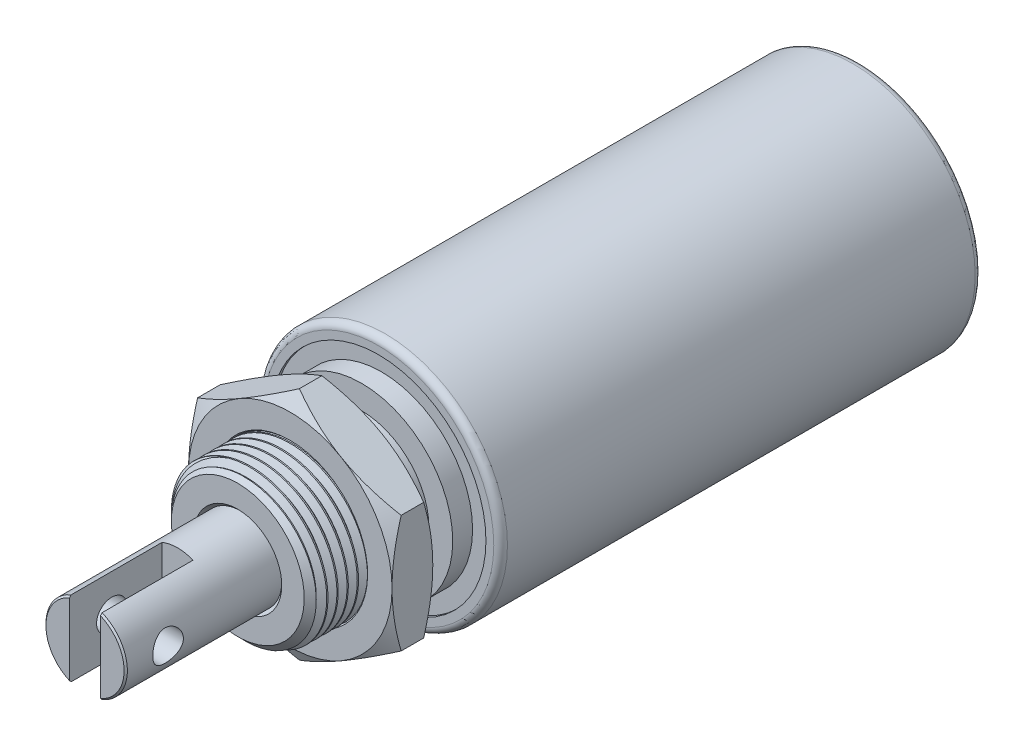
from build123d import *

# Parameters (mm, degrees)
CUT_EXTRUDE1_REACH                  = 43.339
CUT_EXTRUDE1_END_RADIUS             = 3.175
SKETCH4_W                           = 7.2136
SKETCH4_H                           = 2.413
CUT_EXTRUDE1_DIRECTION_2_REACH      = 43.339
CUT_EXTRUDE1_DIRECTION_2_END_RADIUS = 3.175
CUT_EXTRUDE2_REACH                  = 43.339
CUT_EXTRUDE2_END_RADIUS             = 3.175
SKETCH5_R                           = 1.1938
CUT_EXTRUDE2_DIRECTION_2_REACH      = 43.339
CUT_EXTRUDE2_DIRECTION_2_END_RADIUS = 3.175
CUT_SWEEP1_PITCH                    = 0.79375
BOSS_EXTRUDE3_START                 = 2.38125
SKETCH10_R                          = 5.9436
BOSS_EXTRUDE3_DEPTH                 = 3.175


with BuildPart() as part:
    # Sketch1 → Revolve1 (revolve)
    with BuildSketch(Plane(origin=(0, 0, 0), x_dir=(0, 0, -1), z_dir=(1, 0, 0)), mode=Mode.PRIVATE) as revolve1_sk:
        with BuildLine():
            Line((38.3286, 9.525), (1.8542, 9.525))
            ThreePointArc((1.8542, 9.525), (1.477029243, 9.368770757), (1.3208, 8.9916))
            Line((1.3208, 8.9916), (1.3208, 8.382))
            Line((1.3208, 8.382), (1.5494, 8.382))
            Line((1.5494, 8.382), (1.5494, 7.112))
            Line((1.5494, 7.112), (0, 7.112))
            Line((0, 7.112), (0, 0))
            Line((0, 0), (39.08298, 0))
            Line((39.08298, 0), (39.08298, 2.0066))
            ThreePointArc((39.08298, 2.0066), (39.018256457, 2.162856457), (38.862, 2.22758))
            Line((38.862, 2.22758), (38.862, 8.9916))
            ThreePointArc((38.862, 8.9916), (38.705770757, 9.368770757), (38.3286, 9.525))
        make_face()
    revolve(revolve1_sk.sketch.rotate(Axis((0, 0, -39.08298), (0, 0, 1)), 90), axis=Axis((0, 0, -39.08298), (0, 0, 1)))

    # Sketch2 → Revolve2 (revolve)
    with BuildSketch(Plane(origin=(0, 0, 0), x_dir=(0, 0, -1), z_dir=(1, 0, 0))):
        Polygon((-9.652, 3.429), (-9.652, 5.1816), (-8.89, 5.9436), (-2.3114, 5.9436), (-1.6256, 5.2578), (0, 5.2578), (0, 3.175), (-9.398, 3.175), align=None)
    revolve(axis=Axis((0, 0, 0), (0, 0, 1)))

    # Cut-Sweep1: the profile of Sketch7 screwed along a right-hand helix of 11.112 turns, 8 arcs to a turn; built about Z, then put on its axis
    cut_sweep1_z = Axis((0, 0, 0), (0, 0, 1))
    cut_sweep1_corners = [(5.428044252, 0, -0.396875), (5.428044252, 0, -0.29765625), (5.986562979, 0, 0.024804687), (5.986562979, 0, -0.719335938)]
    with BuildLine(mode=Mode.PRIVATE) as cut_sweep1_profile:
        Line(cut_sweep1_corners[0], cut_sweep1_corners[1])
        Line(cut_sweep1_corners[1], cut_sweep1_corners[2])
        Line(cut_sweep1_corners[2], cut_sweep1_corners[3])
        Line(cut_sweep1_corners[3], cut_sweep1_corners[0])
    cut_sweep1_cap = Face(cut_sweep1_profile.wire())
    cut_sweep1_turn_angles = [0, 22.5, 45, 67.5, 90, 112.5, 135, 157.5, 180, 202.5, 225, 247.5, 270, 292.5, 315, 337.5, 360]
    cut_sweep1_turn_weights = [1, 0.9238795325112867, 1, 0.9238795325112867, 1, 0.9238795325112867, 1, 0.9238795325112867, 1, 0.9238795325112867, 1, 0.9238795325112867, 1, 0.9238795325112867, 1, 0.9238795325112867, 1]
    cut_sweep1_turn_rails = [Edge.make_bspline([Vector(p[0], p[1], 0).rotate(cut_sweep1_z, cut_sweep1_turn_angles[k]) / cut_sweep1_turn_weights[k] + Vector(0, 0, p[2] + CUT_SWEEP1_PITCH * cut_sweep1_turn_angles[k] / 360) for k in range(17)], [0, 0, 0, 1, 1, 2, 2, 3, 3, 4, 4, 5, 5, 6, 6, 7, 7, 8, 8, 8], 2, cut_sweep1_turn_weights) for p in cut_sweep1_corners]
    cut_sweep1_turn_sides = [Face.make_surface_from_curves(cut_sweep1_turn_rails[p[0]], cut_sweep1_turn_rails[p[1]]) for p in [(0, 1), (1, 2), (2, 3), (3, 0)]]
    cut_sweep1_last_angles = [3960, 3980.16, 4000.32]
    cut_sweep1_last_weights = [1, 0.938733857653916, 1]
    cut_sweep1_last_rails = [Edge.make_bspline([Vector(p[0], p[1], 0).rotate(cut_sweep1_z, cut_sweep1_last_angles[k]) / cut_sweep1_last_weights[k] + Vector(0, 0, p[2] + CUT_SWEEP1_PITCH * cut_sweep1_last_angles[k] / 360) for k in range(3)], [0, 0, 0, 1, 1, 1], 2, cut_sweep1_last_weights) for p in cut_sweep1_corners]
    cut_sweep1_last_sides = [Face.make_surface_from_curves(cut_sweep1_last_rails[p[0]], cut_sweep1_last_rails[p[1]]) for p in [(0, 1), (1, 2), (2, 3), (3, 0)]]
    cut_sweep1 = Plane(origin=(0, 0, 9.652), x_dir=(0, 1, 0), z_dir=(0, 0, -1)) * Solid(Shell([*[p.moved(Location((0, 0, CUT_SWEEP1_PITCH * i))) for i in range(11) for p in cut_sweep1_turn_sides], *cut_sweep1_last_sides, cut_sweep1_cap, cut_sweep1_cap.rotate(cut_sweep1_z, 4000.32).moved(Location((0, 0, CUT_SWEEP1_PITCH * 4000.32 / 360)))]))
    add(cut_sweep1, mode=Mode.SUBTRACT)


with BuildPart() as body_2:
    # Sketch3 → Revolve3 (revolve)
    with BuildSketch(Plane(origin=(0, 0, 0), x_dir=(0, 0, -1), z_dir=(1, 0, 0))):
        Polygon((-21.4376, 3.175), (-21.5646, 3.048), (-21.5646, 0), (0, 0), (0, 3.175), align=None)
    revolve(axis=Axis((0, 0, 0), (0, 0, 1)))

    # Cut-Extrude1: up to this cylinder (the profile starts inside it)
    cut_extrude1_end = Plane(origin=(0, 0, 17.9578), z_dir=(0, 0, -1)) * Cylinder(CUT_EXTRUDE1_END_RADIUS, 94.028, mode=Mode.PRIVATE)
    # Sketch4 → Cut-Extrude1 (cut, up to the surface)
    with BuildSketch(Plane(origin=(0, 0, 0), x_dir=(0, 0, -1), z_dir=(0, 1, 0)), mode=Mode.PRIVATE) as cut_extrude1_sk1:
        with Locations((-17.9578, 0)):
            Rectangle(SKETCH4_W, SKETCH4_H)
    cut_extrude1_tool1 = extrude(cut_extrude1_sk1.sketch, amount=-CUT_EXTRUDE1_REACH, mode=Mode.PRIVATE) & cut_extrude1_end
    add(cut_extrude1_tool1.solids().sort_by_distance((0, 0, 17.9578))[0], mode=Mode.SUBTRACT)

    # Cut-Extrude1 direction 2: up to this cylinder (the profile starts inside it)
    cut_extrude1_direction_2_end = Plane(origin=(0, 0, 17.9578), z_dir=(0, 0, -1)) * Cylinder(CUT_EXTRUDE1_DIRECTION_2_END_RADIUS, 94.028, mode=Mode.PRIVATE)
    # Sketch4 → Cut-Extrude1 direction 2 (cut, up to the surface)
    with BuildSketch(Plane(origin=(0, 0, 0), x_dir=(0, 0, -1), z_dir=(0, 1, 0)), mode=Mode.PRIVATE) as cut_extrude1_direction_2_sk1:
        with Locations((-17.9578, 0)):
            Rectangle(SKETCH4_W, SKETCH4_H)
    cut_extrude1_direction_2_tool1 = extrude(cut_extrude1_direction_2_sk1.sketch, amount=CUT_EXTRUDE1_DIRECTION_2_REACH, mode=Mode.PRIVATE) & cut_extrude1_direction_2_end
    add(cut_extrude1_direction_2_tool1.solids().sort_by_distance((0, 0, 17.9578))[0], mode=Mode.SUBTRACT)

    # Cut-Extrude2: up to this cylinder (the profile starts inside it)
    cut_extrude2_end = Plane(origin=(0, 0, 18.2626), z_dir=(0, 0, -1)) * Cylinder(CUT_EXTRUDE2_END_RADIUS, 94.028, mode=Mode.PRIVATE)
    # Sketch5 → Cut-Extrude2 (cut, up to the surface)
    with BuildSketch(Plane(origin=(0, 0, 0), x_dir=(0, -1, 0), z_dir=(1, 0, 0)), mode=Mode.PRIVATE) as cut_extrude2_sk1:
        with Locations(Location((0, -18.2626, 0), (0, 0, 270))):
            Circle(SKETCH5_R)
    cut_extrude2_tool1 = extrude(cut_extrude2_sk1.sketch, amount=CUT_EXTRUDE2_REACH, mode=Mode.PRIVATE) & cut_extrude2_end
    add(cut_extrude2_tool1.solids().sort_by_distance((0, 0, 18.2626))[0], mode=Mode.SUBTRACT)

    # Cut-Extrude2 direction 2: up to this cylinder (the profile starts inside it)
    cut_extrude2_direction_2_end = Plane(origin=(0, 0, 18.2626), z_dir=(0, 0, -1)) * Cylinder(CUT_EXTRUDE2_DIRECTION_2_END_RADIUS, 94.028, mode=Mode.PRIVATE)
    # Sketch5 → Cut-Extrude2 direction 2 (cut, up to the surface)
    with BuildSketch(Plane(origin=(0, 0, 0), x_dir=(0, -1, 0), z_dir=(1, 0, 0)), mode=Mode.PRIVATE) as cut_extrude2_direction_2_sk1:
        with Locations(Location((0, -18.2626, 0), (0, 0, 270))):
            Circle(SKETCH5_R)
    cut_extrude2_direction_2_tool1 = extrude(cut_extrude2_direction_2_sk1.sketch, amount=-CUT_EXTRUDE2_DIRECTION_2_REACH, mode=Mode.PRIVATE) & cut_extrude2_direction_2_end
    add(cut_extrude2_direction_2_tool1.solids().sort_by_distance((0, 0, 18.2626))[0], mode=Mode.SUBTRACT)


with BuildPart() as body_3:
    # Body-Move/Copy1: copy of body 2
    add(body_2.part.moved(Location((0, 0, 12.7))))


with BuildPart() as body_3_2:
    # Sketch10 → Boss-Extrude3 (new body)
    with BuildSketch(Plane.XY.offset(BOSS_EXTRUDE3_START)):
        Polygon((0, 9.165435523), (-7.9375, 4.582717762), (-7.9375, -4.582717762), (0, -9.165435523), (7.9375, -4.582717762), (7.9375, 4.582717762), align=None)
        Circle(SKETCH10_R, mode=Mode.SUBTRACT)
    extrude(amount=BOSS_EXTRUDE3_DEPTH)

    # Sketch11 → Cut-Revolve1 (revolve, cut)
    with BuildSketch(Plane(origin=(0, 0, 0), x_dir=(0, 0, -1), z_dir=(1, 0, 0))):
        Polygon((-5.55625, 9.165435523), (-5.55625, 7.9375), (-4.847301095, 9.165435523), align=None)
        Polygon((-2.38125, 9.165435523), (-2.38125, 7.9375), (-3.090198905, 9.165435523), align=None)
        Polygon((-5.55625, 6.029525958), (-5.55625, 5.9436), (-5.470324042, 5.9436), align=None)
        Polygon((-2.38125, 6.029525958), (-2.38125, 5.9436), (-2.467175958, 5.9436), align=None)
    revolve(axis=Axis((0, 0, 2.38125), (0, 0, 1)), mode=Mode.SUBTRACT)


solid = Compound([part.part, body_2.part, body_3_2.part])
